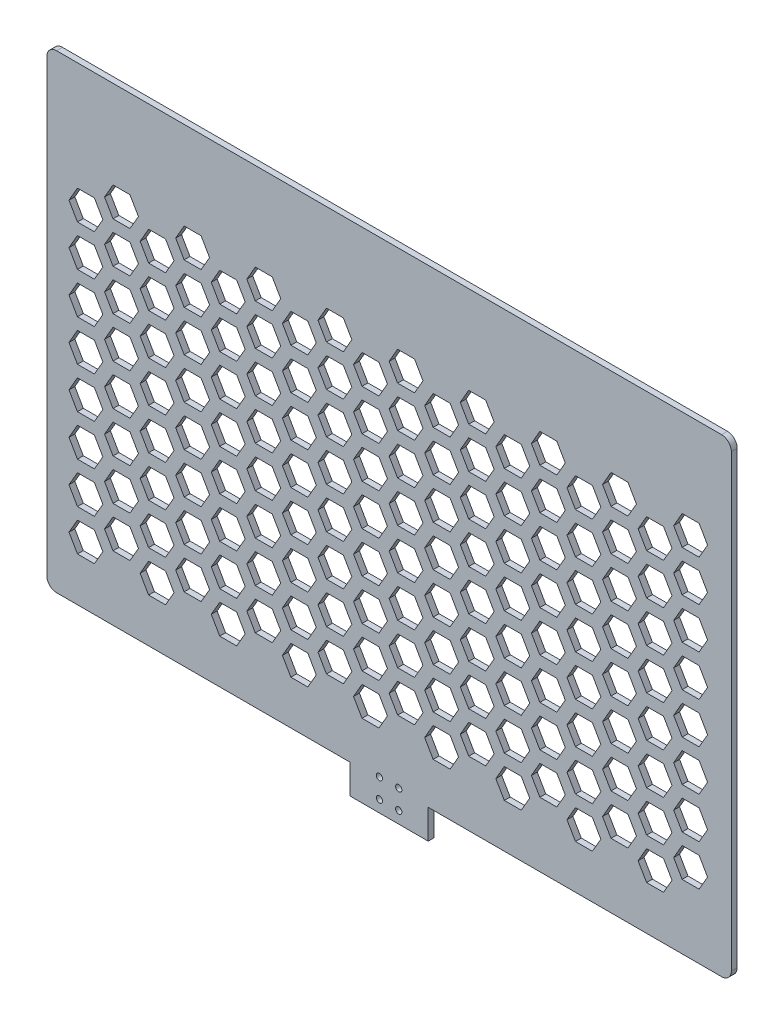
from build123d import *

# Parameters (mm, degrees)
SKETCH_1_W          = 40
SKETCH_1_H          = 22
EXTRUDE_1_DEPTH     = 3
EXTRUDE_2_DEPTH     = 3
SKETCH_4_R          = 1.6
CUT_EXTRUDE_1_DEPTH = 301.283199663
CUT_EXTRUDE_2_DEPTH = 10


with BuildPart() as part:
    # 草图1 → 凸台-拉伸1 (new body)
    with BuildSketch(Plane.XY):
        Rectangle(SKETCH_1_W, SKETCH_1_H)
    extrude(amount=EXTRUDE_1_DEPTH)

    # 草图2 → 凸台-拉伸2 (add)
    with BuildSketch(Plane.XY):
        with BuildLine():
            Line((170, 244), (-170, 244))
            ThreePointArc((-170, 244), (-173.535533906, 242.535533906), (-175, 239))
            Line((-175, 239), (-175, 9))
            ThreePointArc((-175, 9), (-173.535533906, 5.464466094), (-170, 4))
            Line((-170, 4), (170, 4))
            ThreePointArc((170, 4), (173.535533906, 5.464466094), (175, 9))
            Line((175, 9), (175, 239))
            ThreePointArc((175, 239), (173.535533906, 242.535533906), (170, 244))
        make_face()
    extrude(amount=EXTRUDE_2_DEPTH)

    # 草图4 → 切除-拉伸1 (cut, through all)
    with BuildSketch(Plane.XY):
        with Locations((-4.949747468, 4.949747468)):
            Circle(SKETCH_4_R)
        with Locations((4.949747468, 4.949747468)):
            Circle(SKETCH_4_R)
        with Locations((-4.949747468, -4.949747468)):
            Circle(SKETCH_4_R)
        with Locations((4.949747468, -4.949747468)):
            Circle(SKETCH_4_R)
    extrude(amount=CUT_EXTRUDE_1_DEPTH, mode=Mode.SUBTRACT)

    # 草图5 → 切除-拉伸2 (cut)
    with BuildSketch(Plane.XY.offset(3)):
        Polygon((-150.669872981, 26.5), (-146.339745962, 34), (-150.669872981, 41.5), (-159.330127019, 41.5), (-163.660254038, 34), (-159.330127019, 26.5), align=None)
        Polygon((-114.295872981, 26.5), (-109.965745962, 34), (-114.295872981, 41.5), (-122.956127019, 41.5), (-127.286254038, 34), (-122.956127019, 26.5), align=None)
        Polygon((-132.483339502, 37), (-128.153212483, 44.5), (-132.483339502, 52), (-141.143593539, 52), (-145.473720558, 44.5), (-141.143593539, 37), align=None)
        Polygon((-96.109339502, 37), (-91.779212483, 44.5), (-96.109339502, 52), (-104.769593539, 52), (-109.099720558, 44.5), (-104.769593539, 37), align=None)
        Polygon((-77.921872981, 26.5), (-73.591745962, 34), (-77.921872981, 41.5), (-86.582127019, 41.5), (-90.912254038, 34), (-86.582127019, 26.5), align=None)
        Polygon((-59.735339502, 37), (-55.405212483, 44.5), (-59.735339502, 52), (-68.395593539, 52), (-72.725720558, 44.5), (-68.395593539, 37), align=None)
        Polygon((-41.547872981, 26.5), (-37.217745962, 34), (-41.547872981, 41.5), (-50.208127019, 41.5), (-54.538254038, 34), (-50.208127019, 26.5), align=None)
        Polygon((-23.361339502, 37), (-19.031212483, 44.5), (-23.361339502, 52), (-32.021593539, 52), (-36.351720558, 44.5), (-32.021593539, 37), align=None)
        Polygon((-5.173872981, 26.5), (-0.843745962, 34), (-5.173872981, 41.5), (-13.834127019, 41.5), (-18.164254038, 34), (-13.834127019, 26.5), align=None)
        Polygon((13.012660498, 37), (17.342787517, 44.5), (13.012660498, 52), (4.352406461, 52), (0.022279442, 44.5), (4.352406461, 37), align=None)
        Polygon((31.200127019, 26.5), (35.530254038, 34), (31.200127019, 41.5), (22.539872981, 41.5), (18.209745962, 34), (22.539872981, 26.5), align=None)
        Polygon((49.386660498, 37), (53.716787517, 44.5), (49.386660498, 52), (40.726406461, 52), (36.396279442, 44.5), (40.726406461, 37), align=None)
        Polygon((67.574127019, 26.5), (71.904254038, 34), (67.574127019, 41.5), (58.913872981, 41.5), (54.583745962, 34), (58.913872981, 26.5), align=None)
        Polygon((85.760660498, 37), (90.090787517, 44.5), (85.760660498, 52), (77.100406461, 52), (72.770279442, 44.5), (77.100406461, 37), align=None)
        Polygon((103.948127019, 26.5), (108.278254038, 34), (103.948127019, 41.5), (95.287872981, 41.5), (90.957745962, 34), (95.287872981, 26.5), align=None)
        Polygon((122.134660498, 37), (126.464787517, 44.5), (122.134660498, 52), (113.474406461, 52), (109.144279442, 44.5), (113.474406461, 37), align=None)
        Polygon((140.322127019, 26.5), (144.652254038, 34), (140.322127019, 41.5), (131.661872981, 41.5), (127.331745962, 34), (131.661872981, 26.5), align=None)
        Polygon((158.508660498, 37), (162.838787517, 44.5), (158.508660498, 52), (149.848406461, 52), (145.518279442, 44.5), (149.848406461, 37), align=None)
        Polygon((-150.669872981, 47.5), (-146.339745962, 55), (-150.669872981, 62.5), (-159.330127019, 62.5), (-163.660254038, 55), (-159.330127019, 47.5), align=None)
        Polygon((-114.295872981, 47.5), (-109.965745962, 55), (-114.295872981, 62.5), (-122.956127019, 62.5), (-127.286254038, 55), (-122.956127019, 47.5), align=None)
        Polygon((-132.483339502, 58), (-128.153212483, 65.5), (-132.483339502, 73), (-141.143593539, 73), (-145.473720558, 65.5), (-141.143593539, 58), align=None)
        Polygon((-96.109339502, 58), (-91.779212483, 65.5), (-96.109339502, 73), (-104.769593539, 73), (-109.099720558, 65.5), (-104.769593539, 58), align=None)
        Polygon((-77.921872981, 47.5), (-73.591745962, 55), (-77.921872981, 62.5), (-86.582127019, 62.5), (-90.912254038, 55), (-86.582127019, 47.5), align=None)
        Polygon((-59.735339502, 58), (-55.405212483, 65.5), (-59.735339502, 73), (-68.395593539, 73), (-72.725720558, 65.5), (-68.395593539, 58), align=None)
        Polygon((-41.547872981, 47.5), (-37.217745962, 55), (-41.547872981, 62.5), (-50.208127019, 62.5), (-54.538254038, 55), (-50.208127019, 47.5), align=None)
        Polygon((-23.361339502, 58), (-19.031212483, 65.5), (-23.361339502, 73), (-32.021593539, 73), (-36.351720558, 65.5), (-32.021593539, 58), align=None)
        Polygon((-5.173872981, 47.5), (-0.843745962, 55), (-5.173872981, 62.5), (-13.834127019, 62.5), (-18.164254038, 55), (-13.834127019, 47.5), align=None)
        Polygon((13.012660498, 58), (17.342787517, 65.5), (13.012660498, 73), (4.352406461, 73), (0.022279442, 65.5), (4.352406461, 58), align=None)
        Polygon((31.200127019, 47.5), (35.530254038, 55), (31.200127019, 62.5), (22.539872981, 62.5), (18.209745962, 55), (22.539872981, 47.5), align=None)
        Polygon((49.386660498, 58), (53.716787517, 65.5), (49.386660498, 73), (40.726406461, 73), (36.396279442, 65.5), (40.726406461, 58), align=None)
        Polygon((67.574127019, 47.5), (71.904254038, 55), (67.574127019, 62.5), (58.913872981, 62.5), (54.583745962, 55), (58.913872981, 47.5), align=None)
        Polygon((85.760660498, 58), (90.090787517, 65.5), (85.760660498, 73), (77.100406461, 73), (72.770279442, 65.5), (77.100406461, 58), align=None)
        Polygon((103.948127019, 47.5), (108.278254038, 55), (103.948127019, 62.5), (95.287872981, 62.5), (90.957745962, 55), (95.287872981, 47.5), align=None)
        Polygon((122.134660498, 58), (126.464787517, 65.5), (122.134660498, 73), (113.474406461, 73), (109.144279442, 65.5), (113.474406461, 58), align=None)
        Polygon((140.322127019, 47.5), (144.652254038, 55), (140.322127019, 62.5), (131.661872981, 62.5), (127.331745962, 55), (131.661872981, 47.5), align=None)
        Polygon((158.508660498, 58), (162.838787517, 65.5), (158.508660498, 73), (149.848406461, 73), (145.518279442, 65.5), (149.848406461, 58), align=None)
        Polygon((-150.669872981, 68.5), (-146.339745962, 76), (-150.669872981, 83.5), (-159.330127019, 83.5), (-163.660254038, 76), (-159.330127019, 68.5), align=None)
        Polygon((-114.295872981, 68.5), (-109.965745962, 76), (-114.295872981, 83.5), (-122.956127019, 83.5), (-127.286254038, 76), (-122.956127019, 68.5), align=None)
        Polygon((-132.483339502, 79), (-128.153212483, 86.5), (-132.483339502, 94), (-141.143593539, 94), (-145.473720558, 86.5), (-141.143593539, 79), align=None)
        Polygon((-96.109339502, 79), (-91.779212483, 86.5), (-96.109339502, 94), (-104.769593539, 94), (-109.099720558, 86.5), (-104.769593539, 79), align=None)
        Polygon((-77.921872981, 68.5), (-73.591745962, 76), (-77.921872981, 83.5), (-86.582127019, 83.5), (-90.912254038, 76), (-86.582127019, 68.5), align=None)
        Polygon((-59.735339502, 79), (-55.405212483, 86.5), (-59.735339502, 94), (-68.395593539, 94), (-72.725720558, 86.5), (-68.395593539, 79), align=None)
        Polygon((-41.547872981, 68.5), (-37.217745962, 76), (-41.547872981, 83.5), (-50.208127019, 83.5), (-54.538254038, 76), (-50.208127019, 68.5), align=None)
        Polygon((-23.361339502, 79), (-19.031212483, 86.5), (-23.361339502, 94), (-32.021593539, 94), (-36.351720558, 86.5), (-32.021593539, 79), align=None)
        Polygon((-5.173872981, 68.5), (-0.843745962, 76), (-5.173872981, 83.5), (-13.834127019, 83.5), (-18.164254038, 76), (-13.834127019, 68.5), align=None)
        Polygon((13.012660498, 79), (17.342787517, 86.5), (13.012660498, 94), (4.352406461, 94), (0.022279442, 86.5), (4.352406461, 79), align=None)
        Polygon((31.200127019, 68.5), (35.530254038, 76), (31.200127019, 83.5), (22.539872981, 83.5), (18.209745962, 76), (22.539872981, 68.5), align=None)
        Polygon((49.386660498, 79), (53.716787517, 86.5), (49.386660498, 94), (40.726406461, 94), (36.396279442, 86.5), (40.726406461, 79), align=None)
        Polygon((67.574127019, 68.5), (71.904254038, 76), (67.574127019, 83.5), (58.913872981, 83.5), (54.583745962, 76), (58.913872981, 68.5), align=None)
        Polygon((85.760660498, 79), (90.090787517, 86.5), (85.760660498, 94), (77.100406461, 94), (72.770279442, 86.5), (77.100406461, 79), align=None)
        Polygon((103.948127019, 68.5), (108.278254038, 76), (103.948127019, 83.5), (95.287872981, 83.5), (90.957745962, 76), (95.287872981, 68.5), align=None)
        Polygon((122.134660498, 79), (126.464787517, 86.5), (122.134660498, 94), (113.474406461, 94), (109.144279442, 86.5), (113.474406461, 79), align=None)
        Polygon((140.322127019, 68.5), (144.652254038, 76), (140.322127019, 83.5), (131.661872981, 83.5), (127.331745962, 76), (131.661872981, 68.5), align=None)
        Polygon((158.508660498, 79), (162.838787517, 86.5), (158.508660498, 94), (149.848406461, 94), (145.518279442, 86.5), (149.848406461, 79), align=None)
        Polygon((-150.669872981, 89.5), (-146.339745962, 97), (-150.669872981, 104.5), (-159.330127019, 104.5), (-163.660254038, 97), (-159.330127019, 89.5), align=None)
        Polygon((-114.295872981, 89.5), (-109.965745962, 97), (-114.295872981, 104.5), (-122.956127019, 104.5), (-127.286254038, 97), (-122.956127019, 89.5), align=None)
        Polygon((-132.483339502, 100), (-128.153212483, 107.5), (-132.483339502, 115), (-141.143593539, 115), (-145.473720558, 107.5), (-141.143593539, 100), align=None)
        Polygon((-96.109339502, 100), (-91.779212483, 107.5), (-96.109339502, 115), (-104.769593539, 115), (-109.099720558, 107.5), (-104.769593539, 100), align=None)
        Polygon((-77.921872981, 89.5), (-73.591745962, 97), (-77.921872981, 104.5), (-86.582127019, 104.5), (-90.912254038, 97), (-86.582127019, 89.5), align=None)
        Polygon((-59.735339502, 100), (-55.405212483, 107.5), (-59.735339502, 115), (-68.395593539, 115), (-72.725720558, 107.5), (-68.395593539, 100), align=None)
        Polygon((-41.547872981, 89.5), (-37.217745962, 97), (-41.547872981, 104.5), (-50.208127019, 104.5), (-54.538254038, 97), (-50.208127019, 89.5), align=None)
        Polygon((-23.361339502, 100), (-19.031212483, 107.5), (-23.361339502, 115), (-32.021593539, 115), (-36.351720558, 107.5), (-32.021593539, 100), align=None)
        Polygon((-5.173872981, 89.5), (-0.843745962, 97), (-5.173872981, 104.5), (-13.834127019, 104.5), (-18.164254038, 97), (-13.834127019, 89.5), align=None)
        Polygon((13.012660498, 100), (17.342787517, 107.5), (13.012660498, 115), (4.352406461, 115), (0.022279442, 107.5), (4.352406461, 100), align=None)
        Polygon((31.200127019, 89.5), (35.530254038, 97), (31.200127019, 104.5), (22.539872981, 104.5), (18.209745962, 97), (22.539872981, 89.5), align=None)
        Polygon((49.386660498, 100), (53.716787517, 107.5), (49.386660498, 115), (40.726406461, 115), (36.396279442, 107.5), (40.726406461, 100), align=None)
        Polygon((67.574127019, 89.5), (71.904254038, 97), (67.574127019, 104.5), (58.913872981, 104.5), (54.583745962, 97), (58.913872981, 89.5), align=None)
        Polygon((85.760660498, 100), (90.090787517, 107.5), (85.760660498, 115), (77.100406461, 115), (72.770279442, 107.5), (77.100406461, 100), align=None)
        Polygon((103.948127019, 89.5), (108.278254038, 97), (103.948127019, 104.5), (95.287872981, 104.5), (90.957745962, 97), (95.287872981, 89.5), align=None)
        Polygon((122.134660498, 100), (126.464787517, 107.5), (122.134660498, 115), (113.474406461, 115), (109.144279442, 107.5), (113.474406461, 100), align=None)
        Polygon((140.322127019, 89.5), (144.652254038, 97), (140.322127019, 104.5), (131.661872981, 104.5), (127.331745962, 97), (131.661872981, 89.5), align=None)
        Polygon((158.508660498, 100), (162.838787517, 107.5), (158.508660498, 115), (149.848406461, 115), (145.518279442, 107.5), (149.848406461, 100), align=None)
        Polygon((-150.669872981, 110.5), (-146.339745962, 118), (-150.669872981, 125.5), (-159.330127019, 125.5), (-163.660254038, 118), (-159.330127019, 110.5), align=None)
        Polygon((-114.295872981, 110.5), (-109.965745962, 118), (-114.295872981, 125.5), (-122.956127019, 125.5), (-127.286254038, 118), (-122.956127019, 110.5), align=None)
        Polygon((-132.483339502, 121), (-128.153212483, 128.5), (-132.483339502, 136), (-141.143593539, 136), (-145.473720558, 128.5), (-141.143593539, 121), align=None)
        Polygon((-96.109339502, 121), (-91.779212483, 128.5), (-96.109339502, 136), (-104.769593539, 136), (-109.099720558, 128.5), (-104.769593539, 121), align=None)
        Polygon((-77.921872981, 110.5), (-73.591745962, 118), (-77.921872981, 125.5), (-86.582127019, 125.5), (-90.912254038, 118), (-86.582127019, 110.5), align=None)
        Polygon((-59.735339502, 121), (-55.405212483, 128.5), (-59.735339502, 136), (-68.395593539, 136), (-72.725720558, 128.5), (-68.395593539, 121), align=None)
        Polygon((-41.547872981, 110.5), (-37.217745962, 118), (-41.547872981, 125.5), (-50.208127019, 125.5), (-54.538254038, 118), (-50.208127019, 110.5), align=None)
        Polygon((-23.361339502, 121), (-19.031212483, 128.5), (-23.361339502, 136), (-32.021593539, 136), (-36.351720558, 128.5), (-32.021593539, 121), align=None)
        Polygon((-5.173872981, 110.5), (-0.843745962, 118), (-5.173872981, 125.5), (-13.834127019, 125.5), (-18.164254038, 118), (-13.834127019, 110.5), align=None)
        Polygon((13.012660498, 121), (17.342787517, 128.5), (13.012660498, 136), (4.352406461, 136), (0.022279442, 128.5), (4.352406461, 121), align=None)
        Polygon((31.200127019, 110.5), (35.530254038, 118), (31.200127019, 125.5), (22.539872981, 125.5), (18.209745962, 118), (22.539872981, 110.5), align=None)
        Polygon((49.386660498, 121), (53.716787517, 128.5), (49.386660498, 136), (40.726406461, 136), (36.396279442, 128.5), (40.726406461, 121), align=None)
        Polygon((67.574127019, 110.5), (71.904254038, 118), (67.574127019, 125.5), (58.913872981, 125.5), (54.583745962, 118), (58.913872981, 110.5), align=None)
        Polygon((85.760660498, 121), (90.090787517, 128.5), (85.760660498, 136), (77.100406461, 136), (72.770279442, 128.5), (77.100406461, 121), align=None)
        Polygon((103.948127019, 110.5), (108.278254038, 118), (103.948127019, 125.5), (95.287872981, 125.5), (90.957745962, 118), (95.287872981, 110.5), align=None)
        Polygon((122.134660498, 121), (126.464787517, 128.5), (122.134660498, 136), (113.474406461, 136), (109.144279442, 128.5), (113.474406461, 121), align=None)
        Polygon((140.322127019, 110.5), (144.652254038, 118), (140.322127019, 125.5), (131.661872981, 125.5), (127.331745962, 118), (131.661872981, 110.5), align=None)
        Polygon((158.508660498, 121), (162.838787517, 128.5), (158.508660498, 136), (149.848406461, 136), (145.518279442, 128.5), (149.848406461, 121), align=None)
        Polygon((-150.669872981, 131.5), (-146.339745962, 139), (-150.669872981, 146.5), (-159.330127019, 146.5), (-163.660254038, 139), (-159.330127019, 131.5), align=None)
        Polygon((-114.295872981, 131.5), (-109.965745962, 139), (-114.295872981, 146.5), (-122.956127019, 146.5), (-127.286254038, 139), (-122.956127019, 131.5), align=None)
        Polygon((-132.483339502, 142), (-128.153212483, 149.5), (-132.483339502, 157), (-141.143593539, 157), (-145.473720558, 149.5), (-141.143593539, 142), align=None)
        Polygon((-96.109339502, 142), (-91.779212483, 149.5), (-96.109339502, 157), (-104.769593539, 157), (-109.099720558, 149.5), (-104.769593539, 142), align=None)
        Polygon((-77.921872981, 131.5), (-73.591745962, 139), (-77.921872981, 146.5), (-86.582127019, 146.5), (-90.912254038, 139), (-86.582127019, 131.5), align=None)
        Polygon((-59.735339502, 142), (-55.405212483, 149.5), (-59.735339502, 157), (-68.395593539, 157), (-72.725720558, 149.5), (-68.395593539, 142), align=None)
        Polygon((-41.547872981, 131.5), (-37.217745962, 139), (-41.547872981, 146.5), (-50.208127019, 146.5), (-54.538254038, 139), (-50.208127019, 131.5), align=None)
        Polygon((-23.361339502, 142), (-19.031212483, 149.5), (-23.361339502, 157), (-32.021593539, 157), (-36.351720558, 149.5), (-32.021593539, 142), align=None)
        Polygon((-5.173872981, 131.5), (-0.843745962, 139), (-5.173872981, 146.5), (-13.834127019, 146.5), (-18.164254038, 139), (-13.834127019, 131.5), align=None)
        Polygon((13.012660498, 142), (17.342787517, 149.5), (13.012660498, 157), (4.352406461, 157), (0.022279442, 149.5), (4.352406461, 142), align=None)
        Polygon((31.200127019, 131.5), (35.530254038, 139), (31.200127019, 146.5), (22.539872981, 146.5), (18.209745962, 139), (22.539872981, 131.5), align=None)
        Polygon((49.386660498, 142), (53.716787517, 149.5), (49.386660498, 157), (40.726406461, 157), (36.396279442, 149.5), (40.726406461, 142), align=None)
        Polygon((67.574127019, 131.5), (71.904254038, 139), (67.574127019, 146.5), (58.913872981, 146.5), (54.583745962, 139), (58.913872981, 131.5), align=None)
        Polygon((85.760660498, 142), (90.090787517, 149.5), (85.760660498, 157), (77.100406461, 157), (72.770279442, 149.5), (77.100406461, 142), align=None)
        Polygon((103.948127019, 131.5), (108.278254038, 139), (103.948127019, 146.5), (95.287872981, 146.5), (90.957745962, 139), (95.287872981, 131.5), align=None)
        Polygon((122.134660498, 142), (126.464787517, 149.5), (122.134660498, 157), (113.474406461, 157), (109.144279442, 149.5), (113.474406461, 142), align=None)
        Polygon((140.322127019, 131.5), (144.652254038, 139), (140.322127019, 146.5), (131.661872981, 146.5), (127.331745962, 139), (131.661872981, 131.5), align=None)
        Polygon((158.508660498, 142), (162.838787517, 149.5), (158.508660498, 157), (149.848406461, 157), (145.518279442, 149.5), (149.848406461, 142), align=None)
        Polygon((-150.669872981, 152.5), (-146.339745962, 160), (-150.669872981, 167.5), (-159.330127019, 167.5), (-163.660254038, 160), (-159.330127019, 152.5), align=None)
        Polygon((-114.295872981, 152.5), (-109.965745962, 160), (-114.295872981, 167.5), (-122.956127019, 167.5), (-127.286254038, 160), (-122.956127019, 152.5), align=None)
        Polygon((-132.483339502, 163), (-128.153212483, 170.5), (-132.483339502, 178), (-141.143593539, 178), (-145.473720558, 170.5), (-141.143593539, 163), align=None)
        Polygon((-96.109339502, 163), (-91.779212483, 170.5), (-96.109339502, 178), (-104.769593539, 178), (-109.099720558, 170.5), (-104.769593539, 163), align=None)
        Polygon((-77.921872981, 152.5), (-73.591745962, 160), (-77.921872981, 167.5), (-86.582127019, 167.5), (-90.912254038, 160), (-86.582127019, 152.5), align=None)
        Polygon((-59.735339502, 163), (-55.405212483, 170.5), (-59.735339502, 178), (-68.395593539, 178), (-72.725720558, 170.5), (-68.395593539, 163), align=None)
        Polygon((-41.547872981, 152.5), (-37.217745962, 160), (-41.547872981, 167.5), (-50.208127019, 167.5), (-54.538254038, 160), (-50.208127019, 152.5), align=None)
        Polygon((-23.361339502, 163), (-19.031212483, 170.5), (-23.361339502, 178), (-32.021593539, 178), (-36.351720558, 170.5), (-32.021593539, 163), align=None)
        Polygon((-5.173872981, 152.5), (-0.843745962, 160), (-5.173872981, 167.5), (-13.834127019, 167.5), (-18.164254038, 160), (-13.834127019, 152.5), align=None)
        Polygon((13.012660498, 163), (17.342787517, 170.5), (13.012660498, 178), (4.352406461, 178), (0.022279442, 170.5), (4.352406461, 163), align=None)
        Polygon((31.200127019, 152.5), (35.530254038, 160), (31.200127019, 167.5), (22.539872981, 167.5), (18.209745962, 160), (22.539872981, 152.5), align=None)
        Polygon((49.386660498, 163), (53.716787517, 170.5), (49.386660498, 178), (40.726406461, 178), (36.396279442, 170.5), (40.726406461, 163), align=None)
        Polygon((67.574127019, 152.5), (71.904254038, 160), (67.574127019, 167.5), (58.913872981, 167.5), (54.583745962, 160), (58.913872981, 152.5), align=None)
        Polygon((85.760660498, 163), (90.090787517, 170.5), (85.760660498, 178), (77.100406461, 178), (72.770279442, 170.5), (77.100406461, 163), align=None)
        Polygon((103.948127019, 152.5), (108.278254038, 160), (103.948127019, 167.5), (95.287872981, 167.5), (90.957745962, 160), (95.287872981, 152.5), align=None)
        Polygon((122.134660498, 163), (126.464787517, 170.5), (122.134660498, 178), (113.474406461, 178), (109.144279442, 170.5), (113.474406461, 163), align=None)
        Polygon((140.322127019, 152.5), (144.652254038, 160), (140.322127019, 167.5), (131.661872981, 167.5), (127.331745962, 160), (131.661872981, 152.5), align=None)
        Polygon((158.508660498, 163), (162.838787517, 170.5), (158.508660498, 178), (149.848406461, 178), (145.518279442, 170.5), (149.848406461, 163), align=None)
        Polygon((-150.669872981, 173.5), (-146.339745962, 181), (-150.669872981, 188.5), (-159.330127019, 188.5), (-163.660254038, 181), (-159.330127019, 173.5), align=None)
        Polygon((-114.295872981, 173.5), (-109.965745962, 181), (-114.295872981, 188.5), (-122.956127019, 188.5), (-127.286254038, 181), (-122.956127019, 173.5), align=None)
        Polygon((-132.483339502, 184), (-128.153212483, 191.5), (-132.483339502, 199), (-141.143593539, 199), (-145.473720558, 191.5), (-141.143593539, 184), align=None)
        Polygon((-96.109339502, 184), (-91.779212483, 191.5), (-96.109339502, 199), (-104.769593539, 199), (-109.099720558, 191.5), (-104.769593539, 184), align=None)
        Polygon((-77.921872981, 173.5), (-73.591745962, 181), (-77.921872981, 188.5), (-86.582127019, 188.5), (-90.912254038, 181), (-86.582127019, 173.5), align=None)
        Polygon((-59.735339502, 184), (-55.405212483, 191.5), (-59.735339502, 199), (-68.395593539, 199), (-72.725720558, 191.5), (-68.395593539, 184), align=None)
        Polygon((-41.547872981, 173.5), (-37.217745962, 181), (-41.547872981, 188.5), (-50.208127019, 188.5), (-54.538254038, 181), (-50.208127019, 173.5), align=None)
        Polygon((-23.361339502, 184), (-19.031212483, 191.5), (-23.361339502, 199), (-32.021593539, 199), (-36.351720558, 191.5), (-32.021593539, 184), align=None)
        Polygon((-5.173872981, 173.5), (-0.843745962, 181), (-5.173872981, 188.5), (-13.834127019, 188.5), (-18.164254038, 181), (-13.834127019, 173.5), align=None)
        Polygon((13.012660498, 184), (17.342787517, 191.5), (13.012660498, 199), (4.352406461, 199), (0.022279442, 191.5), (4.352406461, 184), align=None)
        Polygon((31.200127019, 173.5), (35.530254038, 181), (31.200127019, 188.5), (22.539872981, 188.5), (18.209745962, 181), (22.539872981, 173.5), align=None)
        Polygon((49.386660498, 184), (53.716787517, 191.5), (49.386660498, 199), (40.726406461, 199), (36.396279442, 191.5), (40.726406461, 184), align=None)
        Polygon((67.574127019, 173.5), (71.904254038, 181), (67.574127019, 188.5), (58.913872981, 188.5), (54.583745962, 181), (58.913872981, 173.5), align=None)
        Polygon((85.760660498, 184), (90.090787517, 191.5), (85.760660498, 199), (77.100406461, 199), (72.770279442, 191.5), (77.100406461, 184), align=None)
        Polygon((103.948127019, 173.5), (108.278254038, 181), (103.948127019, 188.5), (95.287872981, 188.5), (90.957745962, 181), (95.287872981, 173.5), align=None)
        Polygon((122.134660498, 184), (126.464787517, 191.5), (122.134660498, 199), (113.474406461, 199), (109.144279442, 191.5), (113.474406461, 184), align=None)
        Polygon((140.322127019, 173.5), (144.652254038, 181), (140.322127019, 188.5), (131.661872981, 188.5), (127.331745962, 181), (131.661872981, 173.5), align=None)
        Polygon((158.508660498, 184), (162.838787517, 191.5), (158.508660498, 199), (149.848406461, 199), (145.518279442, 191.5), (149.848406461, 184), align=None)
    extrude(amount=-CUT_EXTRUDE_2_DEPTH, mode=Mode.SUBTRACT)


solid = part.part
